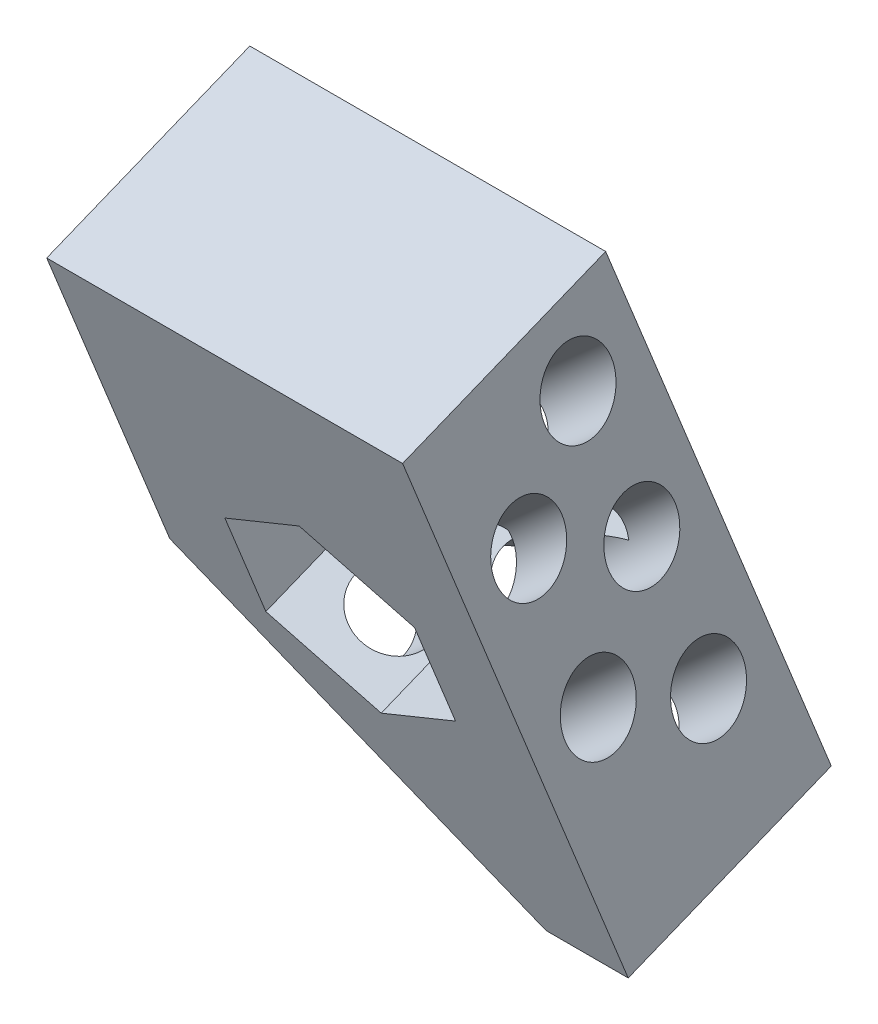
from build123d import *

# Parameters (mm, degrees)
SKETCH1_W           = 110
SKETCH1_H           = 65
BOSS_EXTRUDE1_DEPTH = 40
CHAMFER1_SIZE       = 50
SKETCH2_R           = 6.5
CUT_EXTRUDE1_DEPTH  = 111.623018243
CUT_EXTRUDE2_DEPTH  = 141.021516167


with BuildPart() as part:
    # Sketch1 → Boss-Extrude1 (new body)
    with BuildSketch(Plane(origin=(0, 0, 0), x_dir=(0, -0.9271838545667858, -0.374606593415916), z_dir=(0, 0.374606593415916, -0.9271838545667859))):
        with Locations((55, 32.5)):
            Rectangle(SKETCH1_W, SKETCH1_H)
    extrude(amount=BOSS_EXTRUDE1_DEPTH)

    # Chamfer1
    chamfer1_edges = [part.edges().sort_by_distance(p)[0] for p in [
        (-65, -94.498092134, -59.750402367),
    ]]
    chamfer(chamfer1_edges, length=CHAMFER1_SIZE)

    # Sketch2 → Cut-Extrude1 (cut, through all)
    with BuildSketch(Plane(origin=(-62.5, -57.94899091, -23.412912088), x_dir=(0.1942417080466986, 0.18009777558437512, -0.9642794979074589), z_dir=(-0.7071067811865464, -0.6556179909708572, -0.2648868624815864))):
        with Locations((24.302116706, 41.380596093)):
            Circle(SKETCH2_R)
        with Locations((36.115509488, 24.485515419)):
            Circle(SKETCH2_R)
        with Locations((17.709334516, 18.30387139)):
            Circle(SKETCH2_R)
        with Locations((30.072125815, 3.331851109)):
            Circle(SKETCH2_R)
        with Locations((42.43359242, 46.600709926)):
            Circle(SKETCH2_R)
    extrude(amount=-CUT_EXTRUDE1_DEPTH, mode=Mode.SUBTRACT)

    # Sketch3 → Cut-Extrude2 (cut, through all)
    with BuildSketch(Plane(origin=(0, 14.984263737, -37.087354183), x_dir=(0, -0.9271838545667858, -0.37460659341591607), z_dir=(0, 0.37460659341591607, -0.9271838545667858))):
        Polygon((45, 14.679491924), (65, 14.679491924), (75, 32), (65, 49.320508076), (45, 49.320508076), (35, 32), align=None)
    extrude(amount=-CUT_EXTRUDE2_DEPTH, mode=Mode.SUBTRACT)


solid = part.part
